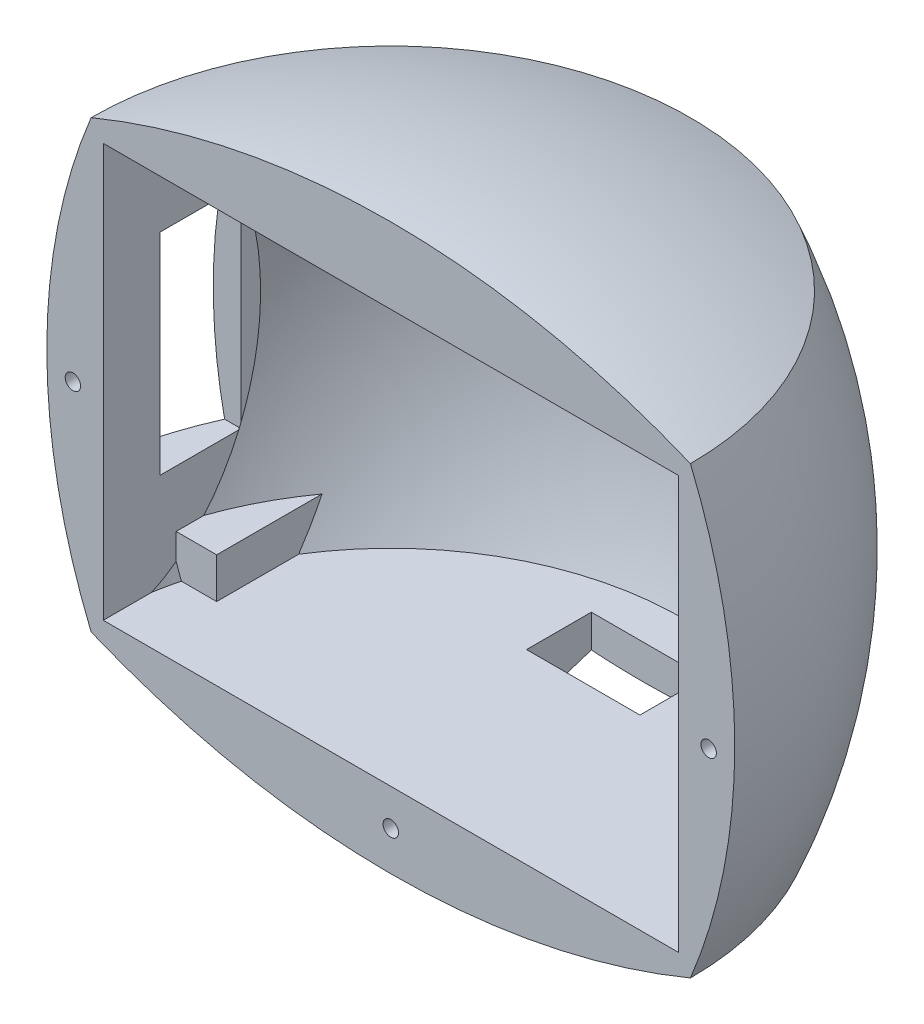
from build123d import *
from OCP.BRepAlgoAPI import BRepAlgoAPI_Cut
from OCP.TopTools import TopTools_ListOfShape

# Parameters (mm, degrees)
REVOLVE2_ANGLE                  = 180
BOSS_EXTRUDE1_REACH             = 71.445
BOSS_EXTRUDE2_DEPTH             = 9.359758
BOSS_EXTRUDE3_REACH             = 64.349
SKETCH10_W                      = 5.000000000000007
SKETCH10_H                      = 4.9999999999999964
SKETCH10_W_2                    = 5.0000000000000036
SKETCH10_H_2                    = 5
BOSS_EXTRUDE3_DIRECTION_2_DEPTH = 4
CUT_EXTRUDE2_DEPTH              = 9.359757593
CUT_EXTRUDE3_DEPTH              = 96.38472758221559
CUT_EXTRUDE4_DEPTH              = 5
SKETCH16_R                      = 0.8750000000000019
CUT_EXTRUDE5_DEPTH              = 82.33463597155567
SKETCH17_R                      = 2.1249999999999996
CUT_EXTRUDE6_DEPTH              = 14.000000000000005
SKETCH18_R                      = 2
CUT_EXTRUDE7_DEPTH              = 14.000000000000005
SKETCH19_R                      = 0.9500000000000007
SKETCH19_R_2                    = 0.9499999999999998
CUT_EXTRUDE8_DEPTH              = 5


with BuildPart() as part:
    # Revolve2: read off the stored shape, not the designer's step
    # Revolve2 outline → Revolve2 (revolve)
    with BuildSketch(Plane.XY):
        with BuildLine():
            ThreePointArc((37, 27.5), (18.862436427, 33.001969759), (0, 34.859757593))
            Line((0, 34.859757593), (0, 32.351769079))
            ThreePointArc((0, 32.351769079), (18.323118863, 30.623589022), (36, 25.5))
            ThreePointArc((36, 25.5), (40.468092327, 0), (36, -25.5))
            ThreePointArc((36, -25.5), (18.323118863, -30.623589022), (0, -32.351769079))
            Line((0, -32.351769079), (0, -34.859757593))
            ThreePointArc((0, -34.859757593), (18.862436427, -33.001969759), (37, -27.5))
            ThreePointArc((37, -27.5), (42.470090103, 0), (37, 27.5))
        make_face()
    revolve(axis=Axis((0, 0, 0), (0, 1, 0)), revolution_arc=REVOLVE2_ANGLE)

    # Sketch7 → Boss-Extrude1 (add, up to next)
    with BuildSketch(Plane.XY, mode=Mode.PRIVATE) as boss_extrude1_sk1:
        with BuildLine():
            ThreePointArc((35.999999999999936, -25.5), (-2.799e-14, -32.35176907915309), (-35.99999999999998, -25.500000000000007))
            ThreePointArc((-35.99999999999998, -25.500000000000007), (-40.46809232693615, -1.37e-14), (-36, 25.500000000000007))
            ThreePointArc((-36, 25.500000000000007), (-8.58e-15, 32.351769078988326), (35.99999999999994, 25.500000000000018))
            ThreePointArc((35.99999999999994, 25.500000000000018), (40.46809232694467, 7.51e-15), (35.999999999999936, -25.5))
        make_face()
        Polygon((35.49999999999999, -25.499999999999993), (-35.50000000000001, -25.500000000000004), (-35.50000000000001, 25.499999999999996), (35.49999999999999, 25.500000000000004), align=None, mode=Mode.SUBTRACT)
    boss_extrude1_tool1 = extrude(boss_extrude1_sk1.sketch, amount=-BOSS_EXTRUDE1_REACH, mode=Mode.PRIVATE) - part.part
    add(boss_extrude1_tool1.solids().sort_by_distance((39.431887, 0, 0))[0])

    # Sketch8 → Boss-Extrude2 (add, through all)
    with BuildSketch(Plane(origin=(3.74e-15, -25.499999999999996, 0), x_dir=(1, 1e-16, 0), z_dir=(-1e-16, 1, 0))):
        Polygon((-17.5, 11.000000000000002), (17.5, 11.000000000000004), (17.5, 23.000000000000004), (-17.5, 23), align=None)
    extrude(amount=-BOSS_EXTRUDE2_DEPTH)

    # Sketch10 → Boss-Extrude3 (add, up to next)
    with BuildSketch(Plane.XY.offset(-13), mode=Mode.PRIVATE) as boss_extrude3_sk1:
        with Locations((-32.999999999999986, -22.999999999999964)):
            Rectangle(SKETCH10_W, SKETCH10_H)
    boss_extrude3_tool1 = extrude(boss_extrude3_sk1.sketch, amount=-BOSS_EXTRUDE3_REACH, mode=Mode.PRIVATE) - part.part
    # Sketch10 → Boss-Extrude3 (add, up to next)
    with BuildSketch(Plane.XY.offset(-13), mode=Mode.PRIVATE) as boss_extrude3_sk2:
        Polygon((-29.999999999999982, 25.500000000000014), (-34.999999999999986, 25.500000000000014), (-34.999999999999986, 20.500000000000018), (-29.999999999999982, 20.500000000000014), align=None)
    boss_extrude3_tool2 = extrude(boss_extrude3_sk2.sketch, amount=-BOSS_EXTRUDE3_REACH, mode=Mode.PRIVATE) - part.part
    # Sketch10 → Boss-Extrude3 (add, up to next)
    with BuildSketch(Plane.XY.offset(-13), mode=Mode.PRIVATE) as boss_extrude3_sk3:
        Polygon((30.499999999999975, -25.49999999999996), (35.49999999999998, -25.49999999999996), (35.49999999999998, -20.499999999999968), (30.499999999999975, -20.499999999999964), align=None)
    boss_extrude3_tool3 = extrude(boss_extrude3_sk3.sketch, amount=-BOSS_EXTRUDE3_REACH, mode=Mode.PRIVATE) - part.part
    # Sketch10 → Boss-Extrude3 (add, up to next)
    with BuildSketch(Plane.XY.offset(-13), mode=Mode.PRIVATE) as boss_extrude3_sk4:
        with Locations((32.99999999999998, 23.00000000000002)):
            Rectangle(SKETCH10_W_2, SKETCH10_H_2)
    boss_extrude3_tool4 = extrude(boss_extrude3_sk4.sketch, amount=-BOSS_EXTRUDE3_REACH, mode=Mode.PRIVATE) - part.part
    add(boss_extrude3_tool1.solids().sort_by_distance((-33, -23, -13))[0])
    add(boss_extrude3_tool2.solids().sort_by_distance((-32.5, 23, -13))[0])
    add(boss_extrude3_tool3.solids().sort_by_distance((33, -23, -13))[0])
    add(boss_extrude3_tool4.solids().sort_by_distance((33, 23, -13))[0])

    # Sketch10 → Boss-Extrude3 direction 2 (add)
    with BuildSketch(Plane.XY.offset(-13)):
        with Locations((-32.999999999999986, -22.999999999999964)):
            Rectangle(SKETCH10_W, SKETCH10_H)
        Polygon((-29.999999999999982, 25.500000000000014), (-34.999999999999986, 25.500000000000014), (-34.999999999999986, 20.500000000000018), (-29.999999999999982, 20.500000000000014), align=None)
        Polygon((30.499999999999975, -25.49999999999996), (35.49999999999998, -25.49999999999996), (35.49999999999998, -20.499999999999968), (30.499999999999975, -20.499999999999964), align=None)
        with Locations((32.99999999999998, 23.00000000000002)):
            Rectangle(SKETCH10_W_2, SKETCH10_H_2)
    extrude(amount=BOSS_EXTRUDE3_DIRECTION_2_DEPTH)

    # Sketch12 → Cut-Extrude2 (cut)
    with BuildSketch(Plane.XZ.offset(34.85975759304736)):
        Polygon((-6.236956636801239, -23.000000000000004), (7.763043363198761, -23.000000000000004), (7.763043363198763, -31.000000000000004), (-6.236956636801237, -31.000000000000004), align=None)
    extrude(amount=-CUT_EXTRUDE2_DEPTH, mode=Mode.SUBTRACT)

    # Sketch14 → Cut-Extrude3 (cut, through all)
    with BuildSketch(Plane(origin=(-35.50000000000001, 0, 0), x_dir=(0, 0, -1), z_dir=(1, 0, 0))):
        Polygon((17, 12.500000000000023), (7.000000000000001, 12.500000000000023), (7.0000000000000036, -13.499999999999975), (17.000000000000004, -13.499999999999975), align=None)
    extrude(amount=-CUT_EXTRUDE3_DEPTH, mode=Mode.SUBTRACT)


with BuildPart() as cut_extrude4_tool:
    # Sketch15 → Cut-Extrude4 (new body)
    with BuildSketch(Plane.XZ.offset(34.85975759304736)):
        Polygon((-15.500000000000004, -15.000000000000004), (15.499999999999996, -15.000000000000004), (15.499999999999998, -23.000000000000004), (-15.500000000000004, -23.000000000000004), align=None)
    extrude(amount=-CUT_EXTRUDE4_DEPTH)


with BuildPart() as part_1:
    add(part.part)

    # Cut-Extrude4: cut by cut_extrude4_tool, with a tolerance
    cut_extrude4_stock = TopTools_ListOfShape()
    cut_extrude4_stock.Append(part_1.part.wrapped)
    cut_extrude4_tools = TopTools_ListOfShape()
    cut_extrude4_tools.Append(cut_extrude4_tool.part.wrapped)
    cut_extrude4_cut = BRepAlgoAPI_Cut()
    cut_extrude4_cut.SetArguments(cut_extrude4_stock)
    cut_extrude4_cut.SetTools(cut_extrude4_tools)
    cut_extrude4_cut.SetFuzzyValue(0.00001)
    cut_extrude4_cut.Build()
    add(Compound.cast(cut_extrude4_cut.Shape()).solids(), mode=Mode.REPLACE)

    # Sketch16 → Cut-Extrude5 (cut, through all)
    with BuildSketch(Plane.ZY.offset(17.5)):
        with Locations(Location((-19, -32.35975759304736, 0), (0, 0, 270))):
            Circle(SKETCH16_R)
    extrude(amount=-CUT_EXTRUDE5_DEPTH, mode=Mode.SUBTRACT)

    # Sketch17 → Cut-Extrude6 (cut)
    with BuildSketch(Plane.ZY.offset(17.5)):
        with Locations((-19, -32.35975759304736)):
            Circle(SKETCH17_R)
    extrude(amount=CUT_EXTRUDE6_DEPTH, mode=Mode.SUBTRACT)

    # Sketch18 → Cut-Extrude7 (cut)
    with BuildSketch(Plane(origin=(17.5, 1.73e-15, 0), x_dir=(0, 0, -1), z_dir=(1, 1e-16, 0))):
        with Locations((19, -32.359757593047355)):
            Circle(SKETCH18_R)
    extrude(amount=CUT_EXTRUDE7_DEPTH, mode=Mode.SUBTRACT)

    # Sketch19 → Cut-Extrude8 (cut)
    with BuildSketch(Plane.XY):
        with Locations((39.24999999999999, -1.862817785759136)):
            Circle(SKETCH19_R)
        with Locations((0, -30.000000000000004)):
            Circle(SKETCH19_R_2)
        with Locations((-39.25000000000001, -1.8628177857591468)):
            Circle(SKETCH19_R)
    extrude(amount=-CUT_EXTRUDE8_DEPTH, mode=Mode.SUBTRACT)


solid = part_1.part
